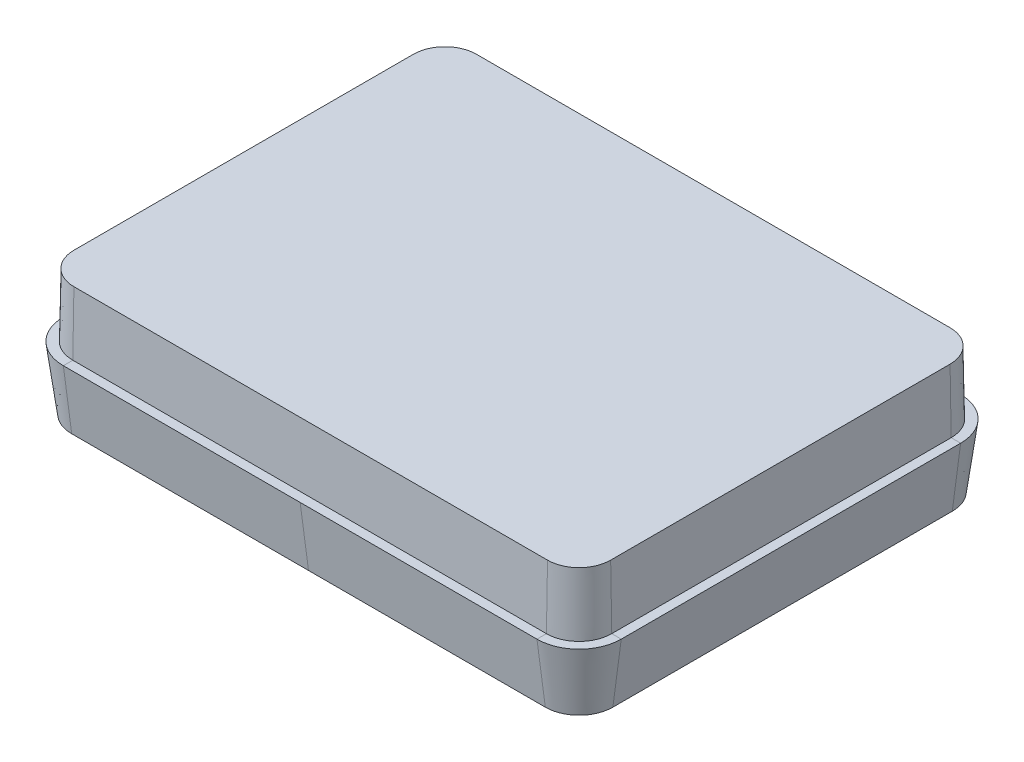
from build123d import *

# Parameters (mm, degrees)
BOSS_EXTRUDE1_DEPTH = 4
BOSS_EXTRUDE1_DRAFT = 1
SHELL1_T            = -0.5
SKETCH2_R           = 2
BOSS_EXTRUDE2_DEPTH = 5.5
BOSS_EXTRUDE2_TAPER = 1.5
CIRPATTERN1_COUNT   = 4
SKETCH4_R           = 1.605977431
CUT_EXTRUDE1_DEPTH  = 5.5
CUT_EXTRUDE1_DRAFT  = 1.5
RIB2_START          = -8.069744096
RIB2_DEPTH          = 6.232014751
RIB2_START_2        = 1.837729345
RIB2_2_DEPTH        = 6.232014751
RIB2_START_3        = -0.25
RIB2_3_DEPTH        = 0.4999999
RIB2_START_4        = -5.909834066
RIB2_4_DEPTH        = 4.072104721
RIB2_5_DEPTH        = 4.072104621


with BuildPart() as part:
    # Sketch1 → Boss-Extrude1 (with draft: the straight prism first)
    with BuildSketch(Plane(origin=(0, 0, 0), x_dir=(1, 0, 0), z_dir=(0, 1, 0))):
        with BuildLine():
            Line((-7.5, -6.375), (7.5, -6.375))
            ThreePointArc((7.5, -6.375), (8.207106781, -6.082106781), (8.5, -5.375))
            Line((8.5, -5.375), (8.5, 5.375))
            ThreePointArc((8.5, 5.375), (8.207106781, 6.082106781), (7.5, 6.375))
            Line((7.5, 6.375), (-7.5, 6.375))
            ThreePointArc((-7.5, 6.375), (-8.207106781, 6.082106781), (-8.5, 5.375))
            Line((-8.5, 5.375), (-8.5, -5.375))
            ThreePointArc((-8.5, -5.375), (-8.207106781, -6.082106781), (-7.5, -6.375))
        make_face()
    extrude(amount=-BOSS_EXTRUDE1_DEPTH)
    # Boss-Extrude1: the draft: its side faces are tilted about the plane it starts from
    boss_extrude1_sides = [part.faces().sort_by_distance(p)[0] for p in [
        (0, -2, 6.375),
        (8.207106781, -2, 6.082106781),
        (8.5, -2, 0),
        (8.207106781, -2, -6.082106781),
        (0, -2, -6.375),
        (-8.207106781, -2, -6.082106781),
        (-8.5, -2, 0),
        (-8.207106781, -2, 6.082106781),
    ]]
    draft(boss_extrude1_sides, Plane(origin=(0, 0, 0), x_dir=(1, 0, 0), z_dir=(0, 1, 0)), BOSS_EXTRUDE1_DRAFT)

    # Shell1
    shell1_openings = [part.faces().sort_by_distance(p)[0] for p in [
        (0, -4, 0),
    ]]
    offset(amount=SHELL1_T, openings=shell1_openings, kind=Kind.INTERSECTION)

    # Sketch2 → Boss-Extrude2 (add)
    with BuildSketch(Plane.XZ.offset(0.5)):
        Circle(SKETCH2_R)
    extrude(amount=BOSS_EXTRUDE2_DEPTH, taper=BOSS_EXTRUDE2_TAPER)

    # Rib1: read off the stored shape, not the designer's step
    # Rib1: loft between two sections, ruled curve by curve
    rib1_from = [
        Edge.make_line((1.982302644, -0.5, 0.265473592), (2.872170331, -0.5, 0.25)),
        Edge.make_line((1.982302644, -0.5, -0.265473592), (2.872170331, -0.5, -0.25)),
        Edge.make_line((2.872170331, -0.5, -0.25), (2.872170331, -0.5, 0.25)),
        Edge.make_line((1.982302644, -0.5, -0.265473592), (1.982302644, -0.5, 0.265473592)),
    ]
    rib1_to = [
        Edge.make_line((1.837729445, -6, 0.259620323), (2.390982681, -6, 0.25)),
        Edge.make_line((1.837729445, -6, -0.259620323), (2.390982681, -6, -0.25)),
        Edge.make_line((2.390982681, -6, -0.25), (2.390982681, -6, 0.25)),
        Edge.make_line((1.837729445, -6, -0.259620323), (1.837729445, -6, 0.259620323)),
    ]
    rib1 = Solid(Shell([*[Face.make_surface_from_curves(rib1_from[k], rib1_to[k]) for k in range(4)], Face(Wire(rib1_from)), Face(Wire(rib1_to))]))
    add(rib1)

    # CirPattern1: Rib1 ×4 about axis
    cirpattern1_axis = Axis((0, 0, 0), (0, 1, 0))
    for i in range(1, CIRPATTERN1_COUNT):
        add(rib1.rotate(cirpattern1_axis, i * 360 / CIRPATTERN1_COUNT))


with BuildPart() as cut_extrude1_tool:
    # Sketch4 → Cut-Extrude1 (with draft: the straight prism first)
    with BuildSketch(Plane.XZ.offset(6)):
        Circle(SKETCH4_R)
    extrude(amount=-CUT_EXTRUDE1_DEPTH)
    # Cut-Extrude1: the draft: its side faces are tilted about the plane it starts from
    cut_extrude1_sides = [cut_extrude1_tool.faces().sort_by_distance(p)[0] for p in [
        (-1.605977431, -3.25, 0),
    ]]
    draft(cut_extrude1_sides, Plane.XZ.offset(6), CUT_EXTRUDE1_DRAFT)


with BuildPart() as part_1:
    add(part.part)

    # Cut-Extrude1: cut by cut_extrude1_tool
    add(cut_extrude1_tool.part, mode=Mode.SUBTRACT)

    # Sweep1: sweep along a path in Sketch6
    with BuildLine(Plane(origin=(0, -2, 0), x_dir=(1, 0, 0), z_dir=(0, 1, 0))) as sweep1_path:
        Line((8.56982026, -5.375), (8.56982026, 5.375))
        ThreePointArc((8.56982026, 5.375), (8.25647716, 6.13147716), (7.5, 6.44482026))
        Line((7.5, 6.44482026), (-7.5, 6.44482026))
        ThreePointArc((-7.5, 6.44482026), (-8.25647716, 6.13147716), (-8.56982026, 5.375))
        Line((-8.56982026, 5.375), (-8.56982026, -5.375))
        ThreePointArc((-8.56982026, -5.375), (-8.25647716, -6.13147716), (-7.5, -6.44482026))
        Line((-7.5, -6.44482026), (7.5, -6.44482026))
        ThreePointArc((7.5, -6.44482026), (8.25647716, -6.13147716), (8.56982026, -5.375))
    # Sketch5 → Sweep1 (sweep)
    with BuildSketch(Plane(origin=(0, 0, 0), x_dir=(0, 0, -1), z_dir=(1, 0, 0))):
        Polygon((-6.70991013, -2), (-6.44482026, -4), (-6.40991013, -2), align=None)
    sweep(path=sweep1_path.line)

    # Rib2: read off the stored shape, not the designer's step
    # Rib2 outline → Rib2 (add)
    with BuildSketch(Plane.YZ.offset(RIB2_START)):
        Polygon((-0.5, 0.276182597), (-2, 0.25), (-2, -0.25), (-0.5, -0.276182597), align=None)
    extrude(amount=RIB2_DEPTH)

    # Rib2 2 outline → Rib2 2 (add)
    with BuildSketch(Plane.YZ.offset(RIB2_START_2)):
        Polygon((-0.5, 0.276182597), (-2, 0.25), (-2, -0.25), (-0.5, -0.276182597), align=None)
    extrude(amount=RIB2_2_DEPTH)

    # Rib2 3 outline → Rib2 3 (add)
    with BuildSketch(Plane.YZ.offset(RIB2_START_3)):
        Polygon((-2, 2.740937336), (-0.5, 2.872170331), (-0.5, 5.883651368), (-2, 5.909833966), align=None)
        Polygon((-0.5, -5.883651368), (-0.5, -2.872170331), (-2, -2.740937336), (-2, -5.909833966), align=None)
    extrude(amount=RIB2_3_DEPTH)

    # Rib2 4 outline → Rib2 4 (add)
    with BuildSketch(Plane.XY.offset(RIB2_START_4)):
        Polygon((0.25, -2), (0.276182597, -0.5), (0.2499999, -0.5), align=None)
        Polygon((-0.276182597, -0.5), (-0.25, -2), (-0.25, -0.5), align=None)
    extrude(amount=RIB2_4_DEPTH)

    # Rib2 5 outline → Rib2 5 (add)
    with BuildSketch(Plane.XY.offset(RIB2_START_2)):
        Polygon((0.25, -2), (0.276182597, -0.5), (0.2499999, -0.5), align=None)
        Polygon((-0.276182597, -0.5), (-0.25, -2), (-0.25, -0.5), align=None)
    extrude(amount=RIB2_5_DEPTH)


solid = part_1.part
